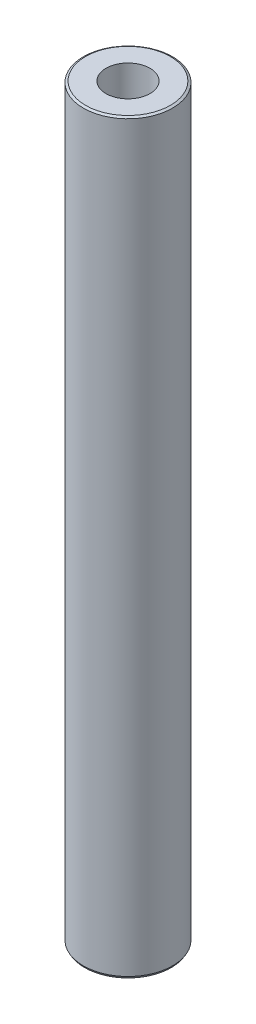
from build123d import *
from OCP.BRepFilletAPI import BRepFilletAPI_MakeChamfer

# Parameters (mm, degrees)
SKETCH1_R           = 30
BOSS_EXTRUDE1_DEPTH = 502.179161113
SKETCH2_R           = 14.807059808
CUT_EXTRUDE1_DEPTH  = 504.968163535
CHAMFER1_SIZE       = 0.85756936
CHAMFER1_SIZE2      = 1.485353702


with BuildPart() as part:
    # Sketch1 → Boss-Extrude1 (new body)
    with BuildSketch(Plane(origin=(0, 0, 0), x_dir=(1, 0, 0), z_dir=(0, 1, 0))):
        Circle(SKETCH1_R)
    extrude(amount=BOSS_EXTRUDE1_DEPTH)

    # Sketch2 → Cut-Extrude1 (cut, through all)
    with BuildSketch(Plane(origin=(0, 0, 0), x_dir=(1, 0, 0), z_dir=(0, 1, 0))):
        Circle(SKETCH2_R)
    extrude(amount=CUT_EXTRUDE1_DEPTH, mode=Mode.SUBTRACT)

    # Chamfer1: one chamfer whose edges measure the first distance from different faces: ONE call of the kernel's chamfer builder (chamfer() names one face for all edges)
    chamfer1_edges_1 = [part.edges().sort_by_distance(p)[0] for p in [
        (-30, 502.179161113, 0),
    ]]
    chamfer1_side_1 = [part.faces().sort_by_distance(p)[0] for p in [
        (-30, 251.089580557, 0),
    ]]
    chamfer1_edges_2 = [part.edges().sort_by_distance(p)[0] for p in [
        (-30, 0, 0),
    ]]
    chamfer1_side_2 = [part.faces().sort_by_distance(p)[0] for p in [
        (-29.151471863, 0, 0),
    ]]
    chamfer1 = BRepFilletAPI_MakeChamfer(part.part.solid().wrapped)
    for e in chamfer1_edges_1:
        chamfer1.Add(CHAMFER1_SIZE, CHAMFER1_SIZE2, e.wrapped, chamfer1_side_1[0].wrapped)  # the first distance lies on this face
    for e in chamfer1_edges_2:
        chamfer1.Add(CHAMFER1_SIZE, CHAMFER1_SIZE2, e.wrapped, chamfer1_side_2[0].wrapped)  # the first distance lies on this face
    add(Compound.cast(chamfer1.Shape()), mode=Mode.REPLACE)


solid = part.part
